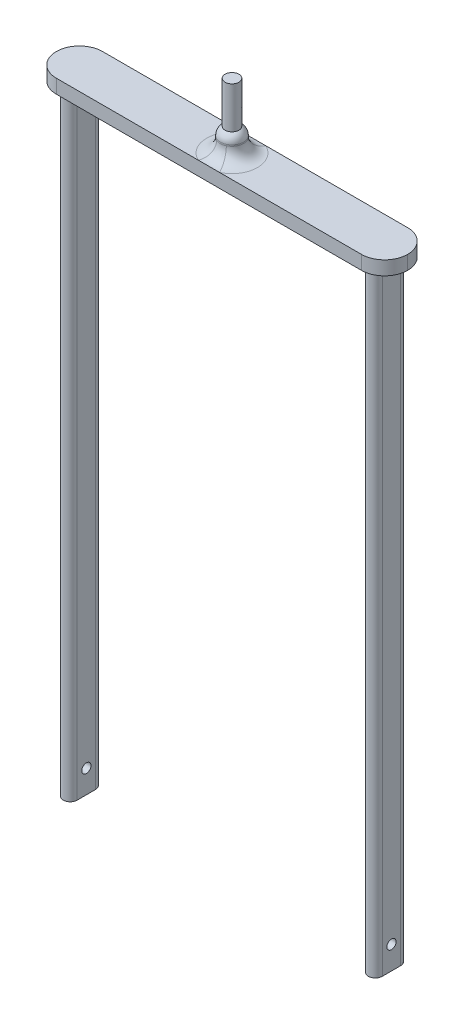
from build123d import *

# Parameters (mm, degrees)
SALIENTE_EXTRUIR1_DEPTH = 3
CROQUIS2_R              = 2.5
SALIENTE_EXTRUIR2_DEPTH = 5
CROQUIS3_R              = 1.5
SALIENTE_EXTRUIR3_DEPTH = 9
REDONDEO1_R             = 2
REDONDEO2_R             = 3
REDONDEO3_R             = 5
SALIENTE_EXTRUIR6_DEPTH = 133
CROQUIS7_R              = 1
CORTAR_EXTRUIR6_DEPTH   = 140


# Some blends are built 0.0001 mm under size
with BuildPart() as part:
    # Croquis1 → Saliente-Extruir1 (new body)
    with BuildSketch(Plane(origin=(0, 0, 0), x_dir=(1, 0, 0), z_dir=(0, 1, 0))):
        Polygon((-38, 0), (-38, 5), (0, 5), (38, 5), (38, 0), (38, -5), (0, -5), (-38, -5), align=None)
    extrude(amount=SALIENTE_EXTRUIR1_DEPTH)

    # Croquis2 → Saliente-Extruir2 (add)
    with BuildSketch(Plane(origin=(0, 3, 0), x_dir=(1, 0, 0), z_dir=(0, 1, 0))):
        with Locations(Location((0, 0, 0), (0, 0, 90))):
            Circle(CROQUIS2_R)
    extrude(amount=SALIENTE_EXTRUIR2_DEPTH)

    # Croquis3 → Saliente-Extruir3 (add)
    with BuildSketch(Plane(origin=(0, 8, 0), x_dir=(1, 0, 0), z_dir=(0, 1, 0))):
        with Locations(Location((0, 0, 0), (0, 0, 270))):
            Circle(CROQUIS3_R)
    extrude(amount=SALIENTE_EXTRUIR3_DEPTH)

    # Redondeo1
    # the kernel refuses this fillet: 2 mm, written as the material it takes off along each edge
    with BuildSketch(Plane(origin=(0, 8, 0), x_dir=(0, 0, -1), z_dir=(1, 0, 0))) as redondeo1_piece_1:
        with BuildLine():
            CenterArc((0.5, -1.732050808), REDONDEO1_R, 0, 60)
            Line((1.5, 0), (1.52, 0.034641016))
            ThreePointArc((1.52, 0.034641016), (2, 0.04), (2.5, 0.04))
            Line((2.5, 0.04), (2.54, 0))
            Line((2.54, 0), (2.54, -1.732050808))
            Line((2.54, -1.732050808), (2.5, -1.732050808))
        make_face()
    revolve(axis=Axis((0, 8, 0), (0, 1, 0)), mode=Mode.SUBTRACT)

    # Redondeo2
    redondeo2_edges = [part.edges().sort_by_distance(p)[0] for p in [
        (0, 3, 2.5),
    ]]
    fillet(redondeo2_edges, radius=REDONDEO2_R)

    # Redondeo3
    redondeo3_edges = [part.edges().sort_by_distance(p)[0] for p in [
        (38, 1.5, 5),
        (38, 1.5, -5),
        (-38, 1.5, -5),
        (-38, 1.5, 5),
    ]]
    fillet(redondeo3_edges, radius=REDONDEO3_R - 0.0001)  # a hair under: the kernel refuses the full size

    # Croquis4 → Saliente-Extruir6 (add)
    with BuildSketch(Plane.XZ):
        with BuildLine():
            Line((-31.5, 2), (-31.5, 0))
            Line((-31.5, 0), (-31.5, -2))
            ThreePointArc((-31.5, -2), (-33, -3.5), (-34.5, -2))
            Line((-34.5, -2), (-34.5, 2))
            ThreePointArc((-34.5, 2), (-33, 3.5), (-31.5, 2))
        make_face()
        with BuildLine():
            Line((31.5, 0), (31.5, -2))
            ThreePointArc((31.5, -2), (33, -3.5), (34.5, -2))
            Line((34.5, -2), (34.5, 2))
            ThreePointArc((34.5, 2), (33, 3.5), (31.5, 2))
            Line((31.5, 2), (31.5, 0))
        make_face()
    extrude(amount=SALIENTE_EXTRUIR6_DEPTH)

    # Croquis7 → Cortar-Extruir6 (cut)
    with BuildSketch(Plane.ZY.offset(34.5)):
        with Locations((0, -128)):
            Circle(CROQUIS7_R)
    extrude(amount=-CORTAR_EXTRUIR6_DEPTH, mode=Mode.SUBTRACT)


solid = part.part
